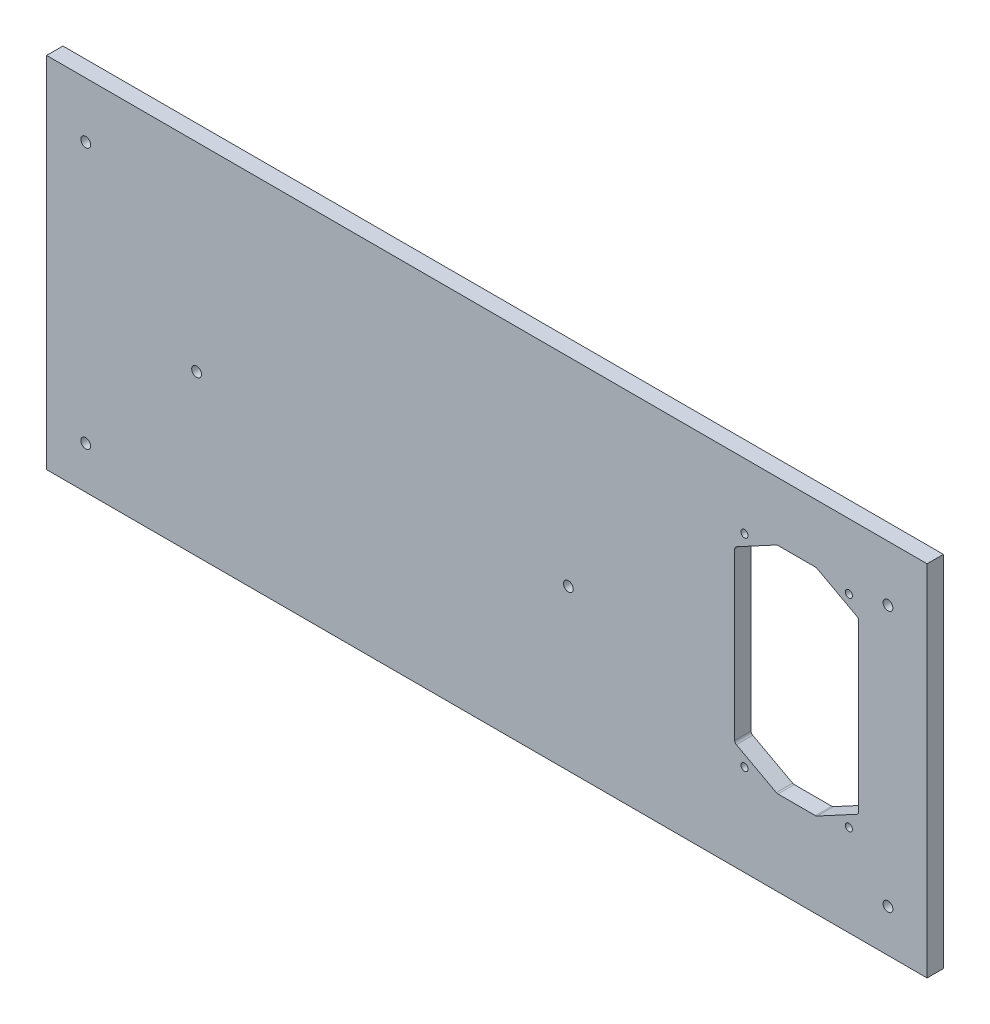
from build123d import *

# Parameters (mm, degrees)
SKETCH1_W             = 270
SKETCH1_H             = 110
BASE_DEPTH            = 2.5
SKETCH2_R             = 1.5
MOUNTHOLES_DEPTH      = 146.859521458
SKETCH3_R             = 1.5
MIDDLEPARTHOLES_DEPTH = 146.859521458
CHAMFERALL_SIZE       = 1.7
SKETCH4_R             = 1.1
CUT_EXTRUDE1_DEPTH    = 146.859521458
FILLET1_R             = 1


with BuildPart() as part:
    # Sketch1 → Base (new, symmetric)
    with BuildSketch(Plane.XY):
        Rectangle(SKETCH1_W, SKETCH1_H)
    extrude(amount=BASE_DEPTH, both=True)

    # Sketch2 → MountHoles (cut, through all)
    with BuildSketch(Plane.XY.offset(2.5)):
        with Locations((-123, -42)):
            Circle(SKETCH2_R)
        with Locations((123, -42)):
            Circle(SKETCH2_R)
        with Locations((123, 38)):
            Circle(SKETCH2_R)
        with Locations((-123, 38)):
            Circle(SKETCH2_R)
    extrude(amount=-MOUNTHOLES_DEPTH, mode=Mode.SUBTRACT)

    # Sketch3 → MiddlePartHoles (cut, through all)
    with BuildSketch(Plane(origin=(0, 0, -2.5), x_dir=(-1, 0, 0), z_dir=(0, 0, -1))):
        with Locations((-25, -6)):
            Circle(SKETCH3_R)
        with Locations((89, -6)):
            Circle(SKETCH3_R)
    extrude(amount=-MIDDLEPARTHOLES_DEPTH, mode=Mode.SUBTRACT)

    # ChamferAll
    chamferall_edges = [part.edges().sort_by_distance(p)[0] for p in [
        (-124.5, -42, -2.5),
        (121.5, -42, -2.5),
        (-124.5, 38, -2.5),
        (121.5, 38, -2.5),
        (-87.5, -6, -2.5),
        (26.5, -6, -2.5),
    ]]
    chamfer(chamferall_edges, length=CHAMFERALL_SIZE)

    # Sketch4 → Cut-Extrude1 (cut, through all)
    with BuildSketch(Plane(origin=(0, 0, -2.5), x_dir=(-1, 0, 0), z_dir=(0, 0, -1))):
        with Locations((-79, 35)):
            Circle(SKETCH4_R)
        with Locations((-111, 35)):
            Circle(SKETCH4_R)
        with Locations((-111, -27)):
            Circle(SKETCH4_R)
        with Locations((-79, -27)):
            Circle(SKETCH4_R)
        Polygon((-101, 37), (-114, 30), (-114, -22), (-101, -29), (-89, -29), (-76, -22), (-76, 30), (-89, 37), align=None)
    extrude(amount=-CUT_EXTRUDE1_DEPTH, mode=Mode.SUBTRACT)

    # Fillet1
    fillet1_edges = [part.edges().sort_by_distance(p)[0] for p in [
        (76, 30, 0),
        (89, -29, 0),
        (101, -29, 0),
        (114, -22, 0),
        (114, 30, 0),
        (101, 37, 0),
        (89, 37, 0),
        (76, -22, 0),
    ]]
    fillet(fillet1_edges, radius=FILLET1_R)


solid = part.part
